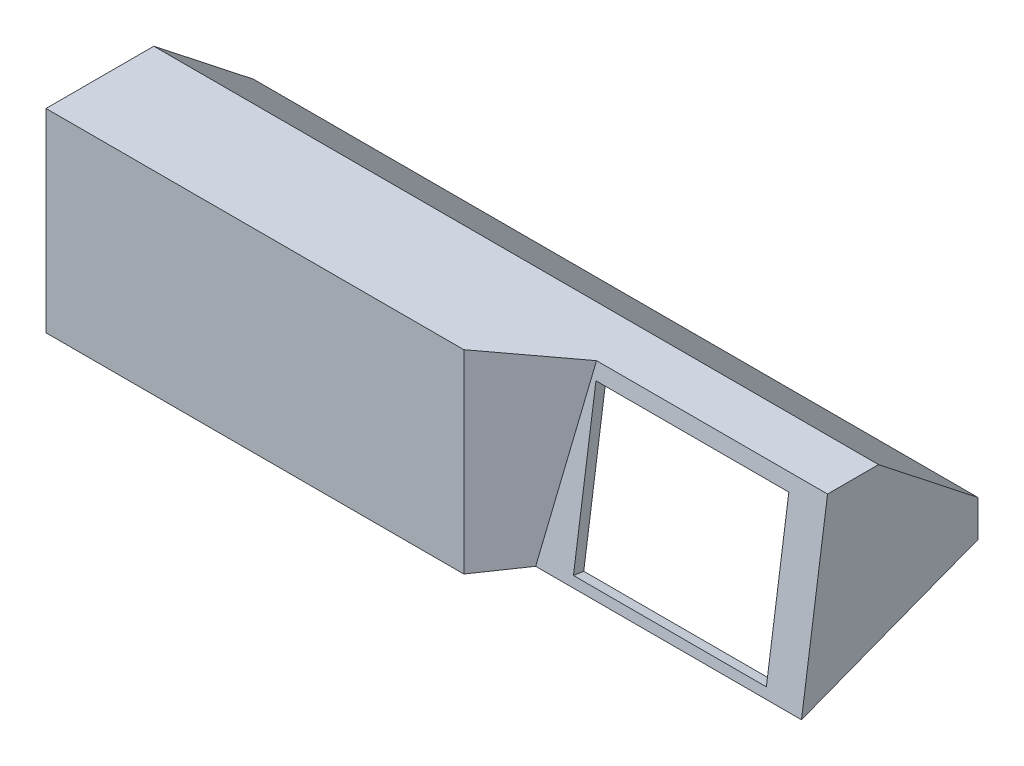
from build123d import *

# Parameters (mm, degrees)
BOSS_EXTRUDE9_DEPTH  = 35
SHELL1_T             = -2
SKETCH25_W           = 37
SKETCH25_H           = 30.5
CUT_EXTRUDE6_DEPTH   = 2
BOSS_EXTRUDE11_REACH = 61.969
CUT_EXTRUDE7_START   = -33
CUT_EXTRUDE7_DEPTH   = 27.688806668
BOSS_EXTRUDE12_DEPTH = 65
CUT_EXTRUDE9_START   = -1.04026
CUT_EXTRUDE9_DEPTH   = 1.04026
BOSS_EXTRUDE13_DEPTH = 4
CUT_EXTRUDE14_DEPTH  = 4


# Read off the part's stored shape, not the designer's step: Cut-Extrude7
with BuildPart() as part:
    # Sketch24 → Boss-Extrude9 (new, symmetric)
    with BuildSketch(Plane(origin=(0, 0, 0), x_dir=(0, 0, -1), z_dir=(1, 0, 0))):
        Polygon((0, 0), (5, 35), (14.77647195, 35), (33.857142857, 20), (33.857142857, 13.020408163), align=None)
    extrude(amount=BOSS_EXTRUDE9_DEPTH, both=True)

    # Shell1
    shell1_openings = [part.faces().sort_by_distance(p)[0] for p in [
        (0, 6.510204082, -16.928571429),
    ]]
    offset(amount=SHELL1_T, openings=shell1_openings, kind=Kind.INTERSECTION)

    # Sketch25 → Cut-Extrude6 (cut)
    with BuildSketch(Plane(origin=(0, 0, 0), x_dir=(1, 0, 0), z_dir=(0, 0.1414213562373094, 0.9899494936611667))):
        with Locations((13.5, 17.105339059)):
            Rectangle(SKETCH25_W, SKETCH25_H)
    extrude(amount=-CUT_EXTRUDE6_DEPTH, mode=Mode.SUBTRACT)

    # Boss-Extrude11: up to this plane
    boss_extrude11_end = Plane(origin=(35, 0, 0), z_dir=(0, 0.9333601055458265, 0.35894137874517024))
    # Sketch27 → Boss-Extrude11 (add, up to the surface)
    with BuildSketch(Plane(origin=(0, 35, 0), x_dir=(1, 0, 0), z_dir=(0, 1, 0)), mode=Mode.PRIVATE) as boss_extrude11_sk1:
        Polygon((-5.311193332, 5), (-19.86581292, -5.902882273), (-35, -5.902882273), (-35, 5), align=None)
    boss_extrude11_tool1 = split(extrude(boss_extrude11_sk1.sketch, amount=-BOSS_EXTRUDE11_REACH, mode=Mode.PRIVATE), bisect_by=boss_extrude11_end, keep=Keep.BOTH, mode=Mode.PRIVATE)
    add(boss_extrude11_tool1.solids().sort_by_distance((-23.400412, 35, -0.138611))[0])

    # Cut-Extrude7 outline → Cut-Extrude7 (cut)
    with BuildSketch(Plane.YZ.offset(CUT_EXTRUDE7_START)):
        Polygon((20.857864376, -5), (1.922845087, -2.294997245), (1.922845087, -5), align=None)
    extrude(amount=CUT_EXTRUDE7_DEPTH, mode=Mode.SUBTRACT)

    # Sketch30 → Boss-Extrude12 (add)
    with BuildSketch(Plane.ZY.offset(35)):
        Polygon((-33.857142857, 20), (-33.857142857, 13.020408163), (5.902882273, -2.270065636), (5.902882273, 35), (-14.77647195, 35), align=None)
    extrude(amount=BOSS_EXTRUDE12_DEPTH)

    # Sketch31 → Cut-Extrude9 (cut)
    with BuildSketch(Plane(origin=(0, 1.922845087, 0), x_dir=(1, 0, 0), z_dir=(0, 1, 0)).offset(CUT_EXTRUDE9_START)):
        Polygon((-8.922191333, 2.294997244), (-5.311193332, 5), (-33, 5), (-33, 2.294997244), align=None)
    extrude(amount=CUT_EXTRUDE9_DEPTH, mode=Mode.SUBTRACT)

    # Sketch26 → Boss-Extrude13 (add)
    with BuildSketch(Plane(origin=(35, 0, 0), x_dir=(0, 0, -1), z_dir=(1, 0, 0))):
        Polygon((5, 35), (0, 0), (33.857142857, 13.020408163), (33.857142857, 20), (14.77647195, 35), align=None)
    extrude(amount=BOSS_EXTRUDE13_DEPTH)

    # Sketch36 → Cut-Extrude14 (cut)
    with BuildSketch(Plane.ZY.offset(-33)):
        Polygon((-31.857142857, 12.251270128), (-2.137749704, 0.822112303), (-6.734590803, 33), (-14.084453997, 33), (-31.857142857, 19.028251617), align=None)
    extrude(amount=-CUT_EXTRUDE14_DEPTH, mode=Mode.SUBTRACT)


solid = part.part
